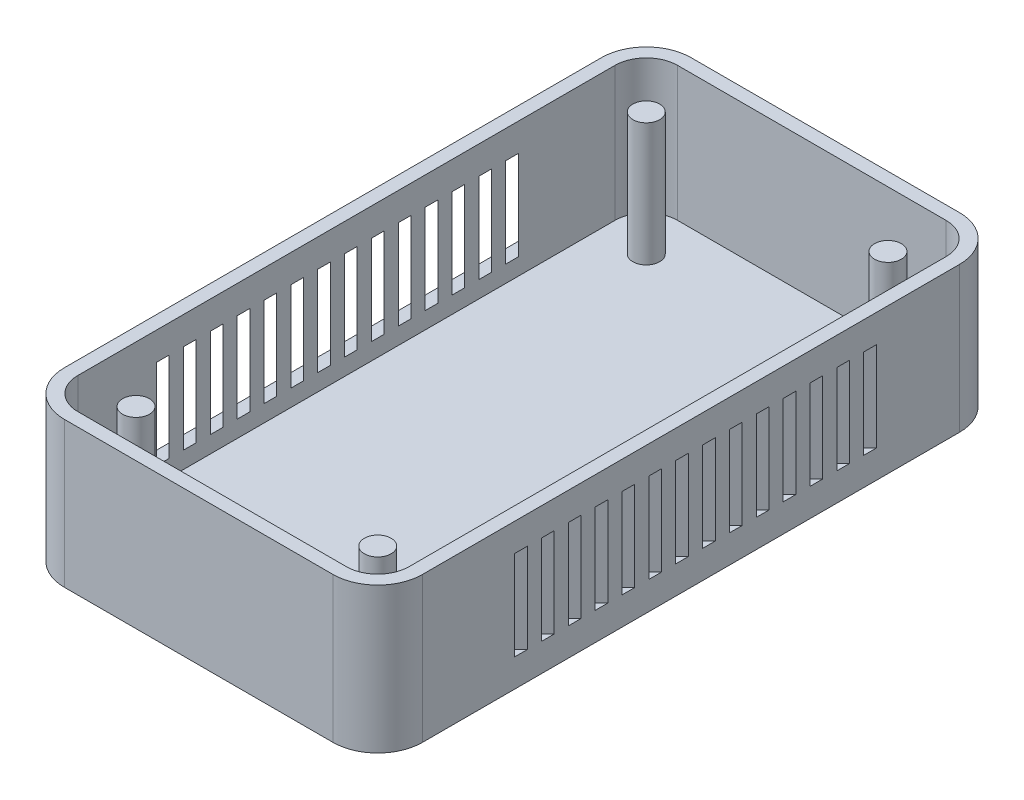
from build123d import *

# Parameters (mm, degrees)
BOSS_EXTRUDE1_DEPTH            = 2.5
BOSS_EXTRUDE2_START            = 2.5
BOSS_EXTRUDE2_DEPTH            = 30
SKETCH1_5_R                    = 3
BOSS_EXTRUDE4_DEPTH            = 30
CUT_EXTRUDE3_REACH             = 134.823
SKETCH8_W                      = 2
SKETCH8_H                      = 20
CUT_EXTRUDE3_DIRECTION_2_REACH = 134.823
LPATTERN1_START                = 6.25
LPATTERN1_DEPTH                = 20


# Read off the part's stored shape, not the designer's step: LPattern1
with BuildPart() as part:
    # Sketch1 → Boss-Extrude1 (new body)
    with BuildSketch(Plane(origin=(0, 0, 0), x_dir=(1, 0, 0), z_dir=(0, 1, 0))):
        with BuildLine():
            Line((-30, 70), (30, 70))
            ThreePointArc((30, 70), (37.071067812, 67.071067812), (40, 60))
            Line((40, 60), (40, -60))
            ThreePointArc((40, -60), (37.071067812, -67.071067812), (30, -70))
            Line((30, -70), (-30, -70))
            ThreePointArc((-30, -70), (-37.071067812, -67.071067812), (-40, -60))
            Line((-40, -60), (-40, 60))
            ThreePointArc((-40, 60), (-37.071067812, 67.071067812), (-30, 70))
        make_face()
    extrude(amount=BOSS_EXTRUDE1_DEPTH)

    # Sketch1<3> → Boss-Extrude2 (add)
    with BuildSketch(Plane(origin=(0, 0, 0), x_dir=(1, 0, 0), z_dir=(0, 1, 0)).offset(BOSS_EXTRUDE2_START)):
        with BuildLine():
            Line((-30, 70), (30, 70))
            ThreePointArc((30, 70), (37.071067812, 67.071067812), (40, 60))
            Line((40, 60), (40, -60))
            ThreePointArc((40, -60), (37.071067812, -67.071067812), (30, -70))
            Line((30, -70), (-30, -70))
            ThreePointArc((-30, -70), (-37.071067812, -67.071067812), (-40, -60))
            Line((-40, -60), (-40, 60))
            ThreePointArc((-40, 60), (-37.071067812, 67.071067812), (-30, 70))
        make_face()
        with BuildLine():
            Line((-37, 60), (-37, -60))
            ThreePointArc((-37, -60), (-34.949747468, -64.949747468), (-30, -67))
            Line((-30, -67), (30, -67))
            ThreePointArc((30, -67), (34.949747468, -64.949747468), (37, -60))
            Line((37, -60), (37, 60))
            ThreePointArc((37, 60), (34.949747468, 64.949747468), (30, 67))
            Line((30, 67), (-30, 67))
            ThreePointArc((-30, 67), (-34.949747468, 64.949747468), (-37, 60))
        make_face(mode=Mode.SUBTRACT)
    extrude(amount=BOSS_EXTRUDE2_DEPTH)

    # Sketch1<5> → Boss-Extrude4 (add)
    with BuildSketch(Plane(origin=(0, 0, 0), x_dir=(1, 0, 0), z_dir=(0, 1, 0))):
        with Locations(Location((27, -57, 0), (0, 0, 270))):
            Circle(SKETCH1_5_R)
        with Locations(Location((-27, -57, 0), (0, 0, 90))):
            Circle(SKETCH1_5_R)
        with Locations(Location((-27, 57, 0), (0, 0, 270))):
            Circle(SKETCH1_5_R)
        with Locations(Location((27, 57, 0), (0, 0, 90))):
            Circle(SKETCH1_5_R)
    extrude(amount=BOSS_EXTRUDE4_DEPTH)

    # Sketch8 → Cut-Extrude3 (cut, up to next)
    with BuildSketch(Plane(origin=(37, 16.25, -37), x_dir=(0.7071067811865538, 0, 0.7071067811865412), z_dir=(-0.7071067811865412, 0, 0.7071067811865538)), mode=Mode.PRIVATE) as cut_extrude3_sk1:
        Rectangle(SKETCH8_W, SKETCH8_H)
    cut_extrude3_tool1 = extrude(cut_extrude3_sk1.sketch, amount=-CUT_EXTRUDE3_REACH, mode=Mode.PRIVATE) & part.part
    cut_extrude3 = cut_extrude3_tool1.solids().sort_by_distance((37, 16.25, -37))[0]
    add(cut_extrude3, mode=Mode.SUBTRACT)

    # Sketch8 → Cut-Extrude3 direction 2 (cut, up to next)
    with BuildSketch(Plane(origin=(37, 16.25, -37), x_dir=(0.7071067811865538, 0, 0.7071067811865412), z_dir=(-0.7071067811865412, 0, 0.7071067811865538)), mode=Mode.PRIVATE) as cut_extrude3_direction_2_sk1:
        Rectangle(SKETCH8_W, SKETCH8_H)
    cut_extrude3_direction_2_tool1 = extrude(cut_extrude3_direction_2_sk1.sketch, amount=CUT_EXTRUDE3_DIRECTION_2_REACH, mode=Mode.PRIVATE) & part.part
    cut_extrude3_direction_2 = cut_extrude3_direction_2_tool1.solids().sort_by_distance((37, 16.25, -37))[0]
    add(cut_extrude3_direction_2, mode=Mode.SUBTRACT)

    # LPattern1 outline → LPattern1 (cut)
    with BuildSketch(Plane(origin=(0, 0, 0), x_dir=(1, 0, 0), z_dir=(0, 1, 0)).offset(LPATTERN1_START)):
        Polygon((37, -42.414213562), (40, -39.414213562), (40, -36.585786438), (37, -39.585786438), align=None)
        Polygon((37, -36.414213562), (40, -33.414213562), (40, -30.585786438), (37, -33.585786438), align=None)
        Polygon((37, -30.414213562), (40, -27.414213562), (40, -24.585786438), (37, -27.585786438), align=None)
        Polygon((37, -24.414213562), (40, -21.414213562), (40, -18.585786438), (37, -21.585786438), align=None)
        Polygon((37, -18.414213562), (40, -15.414213562), (40, -12.585786438), (37, -15.585786438), align=None)
        Polygon((37, -12.414213562), (40, -9.414213562), (40, -6.585786438), (37, -9.585786438), align=None)
        Polygon((37, -6.414213562), (40, -3.414213562), (40, -0.585786438), (37, -3.585786438), align=None)
        Polygon((37, -0.414213562), (40, 2.585786438), (40, 5.414213562), (37, 2.414213562), align=None)
        Polygon((37, 5.585786438), (40, 8.585786438), (40, 11.414213562), (37, 8.414213562), align=None)
        Polygon((37, 11.585786438), (40, 14.585786438), (40, 17.414213562), (37, 14.414213562), align=None)
        Polygon((37, 17.585786438), (40, 20.585786438), (40, 23.414213562), (37, 20.414213562), align=None)
        Polygon((37, 23.585786438), (40, 26.585786438), (40, 29.414213562), (37, 26.414213562), align=None)
        Polygon((37, 29.585786438), (40, 32.585786438), (40, 35.414213562), (37, 32.414213562), align=None)
    lpattern1 = extrude(amount=LPATTERN1_DEPTH, mode=Mode.SUBTRACT)

    # Mirror2: Cut-Extrude3, Cut-Extrude3 direction 2, LPattern1 across plane
    add(cut_extrude3.mirror(Plane(origin=(0, 0, 0), x_dir=(0, 0, 1), z_dir=(1, 0, 0))), mode=Mode.SUBTRACT)
    add(cut_extrude3_direction_2.mirror(Plane(origin=(0, 0, 0), x_dir=(0, 0, 1), z_dir=(1, 0, 0))), mode=Mode.SUBTRACT)
    add(lpattern1.mirror(Plane(origin=(0, 0, 0), x_dir=(0, 0, 1), z_dir=(1, 0, 0))), mode=Mode.SUBTRACT)


solid = part.part
